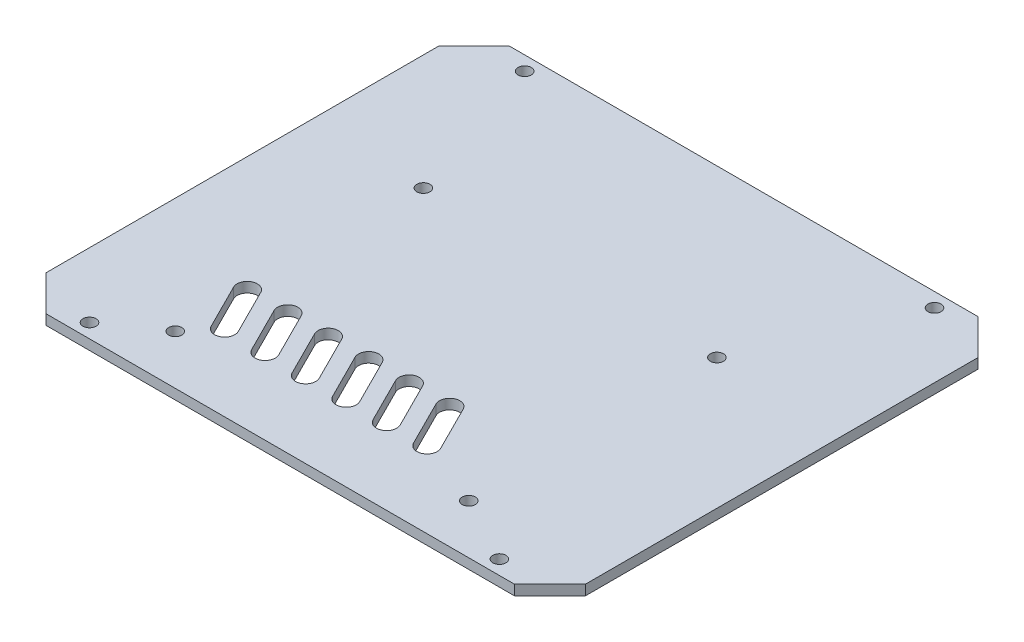
from build123d import *

# Parameters (mm, degrees)
EXTRUDE_1_DEPTH     = 2
CUT_EXTRUDE_1_REACH = 86.3
SKETCH_2_R          = 1.3
CUT_EXTRUDE_2_REACH = 86.3
SKETCH_3_R          = 1.3
CUT_EXTRUDE_3_REACH = 86.3


with BuildPart() as part:
    # 草图1 → 凸台-拉伸1 (new body)
    with BuildSketch(Plane.XZ.offset(21.39)):
        Polygon((-61.8, -50.295836944), (-54.795836944, -57.3), (37.795836944, -57.3), (44.8, -50.295836944), (44.8, 27.295836944), (37.795836944, 34.3), (-54.795836944, 34.3), (-61.8, 27.295836944), align=None)
    extrude(amount=EXTRUDE_1_DEPTH)

    # 草图2 → 切除-拉伸1 (cut, up to next)
    with BuildSketch(Plane.XZ.offset(23.39), mode=Mode.PRIVATE) as cut_extrude_1_sk1:
        with Locations((-39.011567772, -24.5)):
            Circle(SKETCH_2_R)
    cut_extrude_1_tool1 = extrude(cut_extrude_1_sk1.sketch, amount=-CUT_EXTRUDE_1_REACH, mode=Mode.PRIVATE) & part.part
    # 草图2 → 切除-拉伸1 (cut, up to next)
    with BuildSketch(Plane.XZ.offset(23.39), mode=Mode.PRIVATE) as cut_extrude_1_sk2:
        with Locations((19, -24.5)):
            Circle(SKETCH_2_R)
    cut_extrude_1_tool2 = extrude(cut_extrude_1_sk2.sketch, amount=-CUT_EXTRUDE_1_REACH, mode=Mode.PRIVATE) & part.part
    # 草图2 → 切除-拉伸1 (cut, up to next)
    with BuildSketch(Plane.XZ.offset(23.39), mode=Mode.PRIVATE) as cut_extrude_1_sk3:
        with Locations((-39.011567772, 24.535212594)):
            Circle(SKETCH_2_R)
    cut_extrude_1_tool3 = extrude(cut_extrude_1_sk3.sketch, amount=-CUT_EXTRUDE_1_REACH, mode=Mode.PRIVATE) & part.part
    # 草图2 → 切除-拉伸1 (cut, up to next)
    with BuildSketch(Plane.XZ.offset(23.39), mode=Mode.PRIVATE) as cut_extrude_1_sk4:
        with Locations((19, 24.535212594)):
            Circle(SKETCH_2_R)
    cut_extrude_1_tool4 = extrude(cut_extrude_1_sk4.sketch, amount=-CUT_EXTRUDE_1_REACH, mode=Mode.PRIVATE) & part.part
    add(cut_extrude_1_tool1.solids().sort_by_distance((-39.011568, -23.39, -24.5))[0], mode=Mode.SUBTRACT)
    add(cut_extrude_1_tool2.solids().sort_by_distance((19, -23.39, -24.5))[0], mode=Mode.SUBTRACT)
    add(cut_extrude_1_tool3.solids().sort_by_distance((-39.011568, -23.39, 24.535213))[0], mode=Mode.SUBTRACT)
    add(cut_extrude_1_tool4.solids().sort_by_distance((19, -23.39, 24.535213))[0], mode=Mode.SUBTRACT)

    # 草图3 → 切除-拉伸2 (cut, up to next)
    with BuildSketch(Plane.XZ.offset(23.39), mode=Mode.PRIVATE) as cut_extrude_2_sk1:
        with Locations((32, -54.5)):
            Circle(SKETCH_3_R)
    cut_extrude_2_tool1 = extrude(cut_extrude_2_sk1.sketch, amount=-CUT_EXTRUDE_2_REACH, mode=Mode.PRIVATE) & part.part
    # 草图3 → 切除-拉伸2 (cut, up to next)
    with BuildSketch(Plane.XZ.offset(23.39), mode=Mode.PRIVATE) as cut_extrude_2_sk2:
        with Locations((-49, -54.5)):
            Circle(SKETCH_3_R)
    cut_extrude_2_tool2 = extrude(cut_extrude_2_sk2.sketch, amount=-CUT_EXTRUDE_2_REACH, mode=Mode.PRIVATE) & part.part
    # 草图3 → 切除-拉伸2 (cut, up to next)
    with BuildSketch(Plane.XZ.offset(23.39), mode=Mode.PRIVATE) as cut_extrude_2_sk3:
        with Locations((32, 31.5)):
            Circle(SKETCH_3_R)
    cut_extrude_2_tool3 = extrude(cut_extrude_2_sk3.sketch, amount=-CUT_EXTRUDE_2_REACH, mode=Mode.PRIVATE) & part.part
    # 草图3 → 切除-拉伸2 (cut, up to next)
    with BuildSketch(Plane.XZ.offset(23.39), mode=Mode.PRIVATE) as cut_extrude_2_sk4:
        with Locations((-49, 31.5)):
            Circle(SKETCH_3_R)
    cut_extrude_2_tool4 = extrude(cut_extrude_2_sk4.sketch, amount=-CUT_EXTRUDE_2_REACH, mode=Mode.PRIVATE) & part.part
    add(cut_extrude_2_tool1.solids().sort_by_distance((32, -23.39, -54.5))[0], mode=Mode.SUBTRACT)
    add(cut_extrude_2_tool2.solids().sort_by_distance((-49, -23.39, -54.5))[0], mode=Mode.SUBTRACT)
    add(cut_extrude_2_tool3.solids().sort_by_distance((32, -23.39, 31.5))[0], mode=Mode.SUBTRACT)
    add(cut_extrude_2_tool4.solids().sort_by_distance((-49, -23.39, 31.5))[0], mode=Mode.SUBTRACT)

    # 草图4 → 切除-拉伸3 (cut, up to next)
    with BuildSketch(Plane.XZ.offset(23.39), mode=Mode.PRIVATE) as cut_extrude_3_sk1:
        with BuildLine():
            Line((-40.815898212, 11.196756986), (-36.332113283, 20.13519492))
            ThreePointArc((-36.332113283, 20.13519492), (-33.64766871, 21.026125521), (-32.756738109, 18.341680948))
            Line((-32.756738109, 18.341680948), (-37.240523038, 9.403243014))
            ThreePointArc((-37.240523038, 9.403243014), (-39.924967611, 8.512312413), (-40.815898212, 11.196756986))
        make_face()
    cut_extrude_3_tool1 = extrude(cut_extrude_3_sk1.sketch, amount=-CUT_EXTRUDE_3_REACH, mode=Mode.PRIVATE) & part.part
    # 草图4 → 切除-拉伸3 (cut, up to next)
    with BuildSketch(Plane.XZ.offset(23.39), mode=Mode.PRIVATE) as cut_extrude_3_sk2:
        with BuildLine():
            Line((-32.815898212, 11.196756986), (-28.332113283, 20.13519492))
            ThreePointArc((-28.332113283, 20.13519492), (-25.64766871, 21.026125521), (-24.756738109, 18.341680948))
            Line((-24.756738109, 18.341680948), (-29.240523038, 9.403243014))
            ThreePointArc((-29.240523038, 9.403243014), (-31.924967611, 8.512312413), (-32.815898212, 11.196756986))
        make_face()
    cut_extrude_3_tool2 = extrude(cut_extrude_3_sk2.sketch, amount=-CUT_EXTRUDE_3_REACH, mode=Mode.PRIVATE) & part.part
    # 草图4 → 切除-拉伸3 (cut, up to next)
    with BuildSketch(Plane.XZ.offset(23.39), mode=Mode.PRIVATE) as cut_extrude_3_sk3:
        with BuildLine():
            Line((-24.815898212, 11.196756986), (-20.332113283, 20.13519492))
            ThreePointArc((-20.332113283, 20.13519492), (-17.64766871, 21.026125521), (-16.756738109, 18.341680948))
            Line((-16.756738109, 18.341680948), (-21.240523038, 9.403243014))
            ThreePointArc((-21.240523038, 9.403243014), (-23.924967611, 8.512312413), (-24.815898212, 11.196756986))
        make_face()
    cut_extrude_3_tool3 = extrude(cut_extrude_3_sk3.sketch, amount=-CUT_EXTRUDE_3_REACH, mode=Mode.PRIVATE) & part.part
    # 草图4 → 切除-拉伸3 (cut, up to next)
    with BuildSketch(Plane.XZ.offset(23.39), mode=Mode.PRIVATE) as cut_extrude_3_sk4:
        with BuildLine():
            Line((-16.815898212, 11.196756986), (-12.332113283, 20.13519492))
            ThreePointArc((-12.332113283, 20.13519492), (-9.64766871, 21.026125521), (-8.756738109, 18.341680948))
            Line((-8.756738109, 18.341680948), (-13.240523038, 9.403243014))
            ThreePointArc((-13.240523038, 9.403243014), (-15.924967611, 8.512312413), (-16.815898212, 11.196756986))
        make_face()
    cut_extrude_3_tool4 = extrude(cut_extrude_3_sk4.sketch, amount=-CUT_EXTRUDE_3_REACH, mode=Mode.PRIVATE) & part.part
    # 草图4 → 切除-拉伸3 (cut, up to next)
    with BuildSketch(Plane.XZ.offset(23.39), mode=Mode.PRIVATE) as cut_extrude_3_sk5:
        with BuildLine():
            Line((-8.815898212, 11.196756986), (-4.332113283, 20.13519492))
            ThreePointArc((-4.332113283, 20.13519492), (-1.64766871, 21.026125521), (-0.756738109, 18.341680948))
            Line((-0.756738109, 18.341680948), (-5.240523038, 9.403243014))
            ThreePointArc((-5.240523038, 9.403243014), (-7.924967611, 8.512312413), (-8.815898212, 11.196756986))
        make_face()
    cut_extrude_3_tool5 = extrude(cut_extrude_3_sk5.sketch, amount=-CUT_EXTRUDE_3_REACH, mode=Mode.PRIVATE) & part.part
    # 草图4 → 切除-拉伸3 (cut, up to next)
    with BuildSketch(Plane.XZ.offset(23.39), mode=Mode.PRIVATE) as cut_extrude_3_sk6:
        with BuildLine():
            Line((-0.815898212, 11.196756986), (3.667886717, 20.13519492))
            ThreePointArc((3.667886717, 20.13519492), (6.35233129, 21.026125521), (7.243261891, 18.341680948))
            Line((7.243261891, 18.341680948), (2.759476962, 9.403243014))
            ThreePointArc((2.759476962, 9.403243014), (0.075032389, 8.512312413), (-0.815898212, 11.196756986))
        make_face()
    cut_extrude_3_tool6 = extrude(cut_extrude_3_sk6.sketch, amount=-CUT_EXTRUDE_3_REACH, mode=Mode.PRIVATE) & part.part
    add(cut_extrude_3_tool1.solids().sort_by_distance((-36.786318, -23.39, 14.769219))[0], mode=Mode.SUBTRACT)
    add(cut_extrude_3_tool2.solids().sort_by_distance((-28.786318, -23.39, 14.769219))[0], mode=Mode.SUBTRACT)
    add(cut_extrude_3_tool3.solids().sort_by_distance((-20.786318, -23.39, 14.769219))[0], mode=Mode.SUBTRACT)
    add(cut_extrude_3_tool4.solids().sort_by_distance((-12.786318, -23.39, 14.769219))[0], mode=Mode.SUBTRACT)
    add(cut_extrude_3_tool5.solids().sort_by_distance((-4.786318, -23.39, 14.769219))[0], mode=Mode.SUBTRACT)
    add(cut_extrude_3_tool6.solids().sort_by_distance((3.213682, -23.39, 14.769219))[0], mode=Mode.SUBTRACT)


solid = part.part
